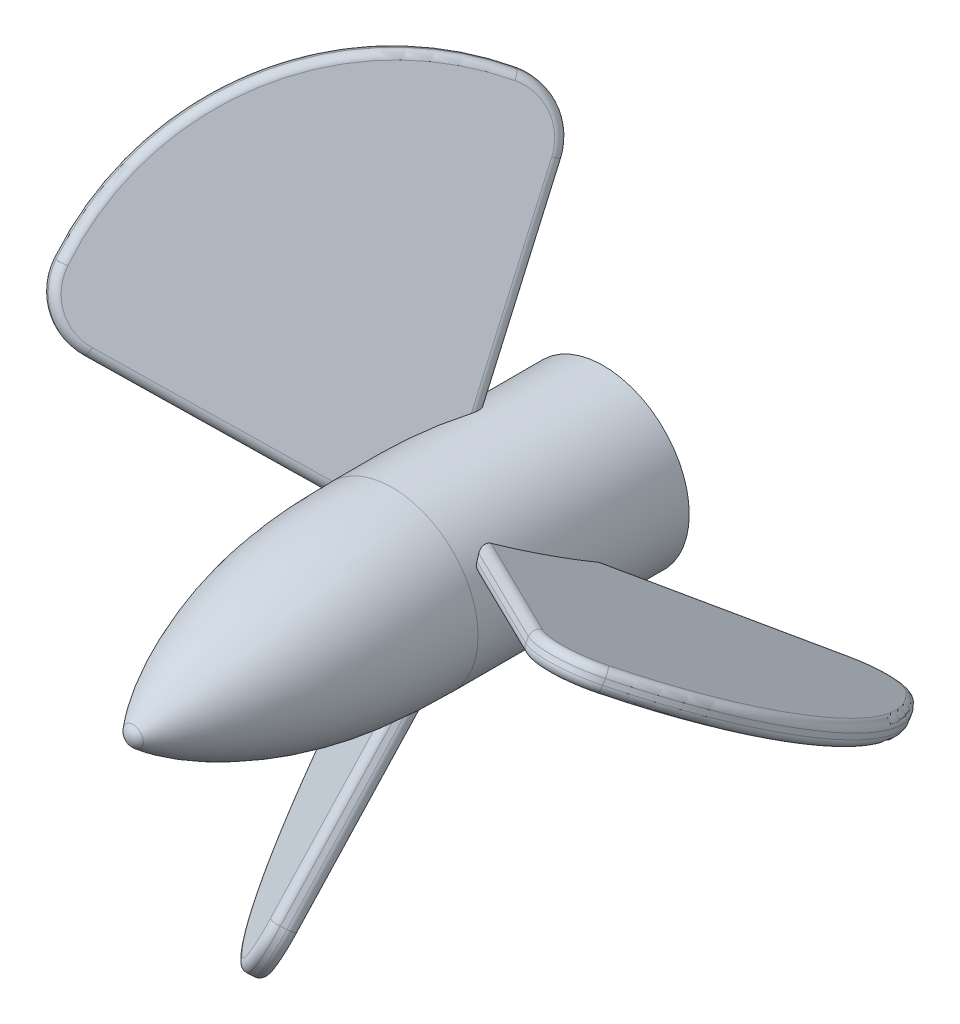
from build123d import *

# Parameters (mm, degrees)
SKETCH1_R                = 3.25
BOSS_EXTRUDE1_DEPTH      = 4
BOSS_EXTRUDE4_DEPTH      = 0.4
FILLET1_R                = 2
CIRPATTERN2_COUNT        = 3
FILLET1_OF_CIRPATTERN2_R = 2
CUT_EXTRUDE1_REACH       = 23.194
FILLET2_R                = 0.3


with BuildPart() as part:
    # Sketch1 → Boss-Extrude1 (new, symmetric)
    with BuildSketch(Plane.XY):
        Circle(SKETCH1_R)
    extrude(amount=BOSS_EXTRUDE1_DEPTH, both=True)

    # Sketch6 → Boss-Extrude4 (add, symmetric)
    with BuildSketch(Plane(origin=(0, 0, 0), x_dir=(-1, 0, 0), z_dir=(0, 0.866025403784438, -0.500000000000001))):
        with BuildLine():
            Line((0, 1.8), (-10, 9.8))
            ThreePointArc((-10, 9.8), (-14, 1.8), (-10, -6.2))
            Line((-10, -6.2), (0, 1.8))
        make_face()
    boss_extrude4 = extrude(amount=BOSS_EXTRUDE4_DEPTH, both=True)

    # Fillet1
    fillet1_edges = [part.edges().sort_by_distance(p)[0] for p in [
        (10, 4.9, 8.487048957),
        (10, -3.1, -5.369357503),
    ]]
    fillet(fillet1_edges, radius=FILLET1_R)

    # CirPattern2: Boss-Extrude4 ×3 about axis
    cirpattern2_axis = Axis((0, 0, 0), (0, 0, 1))
    for i in range(1, CIRPATTERN2_COUNT):
        add(boss_extrude4.rotate(cirpattern2_axis, i * 360 / CIRPATTERN2_COUNT))

    # Fillet1 of CirPattern2
    fillet1_of_cirpattern2_edges = [part.edges().sort_by_distance(p)[0] for p in [
        (-9.243524479, 6.210254038, 8.487048957),
        (-2.315321248, 10.210254038, -5.369357503),
        (-0.756475521, -11.110254038, 8.487048957),
        (-7.684678752, -7.110254038, -5.369357503),
    ]]
    fillet(fillet1_of_cirpattern2_edges, radius=FILLET1_OF_CIRPATTERN2_R)

    # Sketch7 → Cut-Extrude1 (cut, up to next)
    with BuildSketch(Plane.XY.offset(4), mode=Mode.PRIVATE) as cut_extrude1_sk1:
        with BuildLine():
            Line((2.291287847, 1), (1, 1))
            Line((1, 1), (1, 2.291287847))
            ThreePointArc((1, 2.291287847), (0, 2.5), (-1, 2.291287847))
            Line((-1, 2.291287847), (-1, 1))
            Line((-1, 1), (-2.291287847, 1))
            ThreePointArc((-2.291287847, 1), (-2.5, 0), (-2.291287847, -1))
            Line((-2.291287847, -1), (-1, -1))
            Line((-1, -1), (-1, -2.291287847))
            ThreePointArc((-1, -2.291287847), (0, -2.5), (1, -2.291287847))
            Line((1, -2.291287847), (1, -1))
            Line((1, -1), (2.291287847, -1))
            ThreePointArc((2.291287847, -1), (2.5, 0), (2.291287847, 1))
        make_face()
    cut_extrude1_tool1 = extrude(cut_extrude1_sk1.sketch, amount=-CUT_EXTRUDE1_REACH, mode=Mode.PRIVATE) & part.part
    add(cut_extrude1_tool1.solids().sort_by_distance((0, 0, 4))[0], mode=Mode.SUBTRACT)

    # Fillet2
    # the kernel refuses this fillet: 0.3 mm, written as the material it takes off along each edge
    with BuildSketch(Plane(origin=(0.141060168, -2.625278602, 3.285148213), x_dir=(-0.6504736367775011, -0.3457845784397004, -0.6762522260005731), z_dir=(-0.1199335143212854, -0.8324259878891807, 0.5410017808004589))) as fillet2_piece_1_section:
        with BuildLine():
            CenterArc((FILLET2_R, FILLET2_R), FILLET2_R, 180, 90)
            Line((0, FILLET2_R), (0, 0))
            Line((0, 0), (FILLET2_R, 0))
        make_face()
    fillet2_piece_1 = extrude(amount=8.286659003, mode=Mode.PRIVATE)
    fillet2_piece_1 = fillet2_piece_1 - Plane(origin=(0, 0, 5.631920984), x_dir=(1, 0, 0), z_dir=(0, 0, 1)) * Cylinder(3.25, 18, mode=Mode.PRIVATE)
    add(fillet2_piece_1, mode=Mode.SUBTRACT)
    with BuildSketch(Plane(origin=(-2.153735242, -10.214878066, 6.415741038), x_dir=(0.6504736367775003, 0.3457845784397016, 0.6762522260005733), z_dir=(0.11993351432128488, 0.8324259878891804, -0.5410017808004595))) as fillet2_piece_2:
        with BuildLine():
            CenterArc((2 - FILLET2_R, FILLET2_R), FILLET2_R, 270, 90)
            Line((2, FILLET2_R), (2, 0))
            Line((2, 0), (2 - FILLET2_R, 0))
        make_face()
    revolve(axis=Axis((-2.153735242, -10.214878066, 6.415741038), (0.7499999999999993, -0.43301270189221935, -0.500000000000001)), revolution_arc=86.425431617, mode=Mode.SUBTRACT)
    with BuildSketch(Plane(origin=(-1.520577137, -3.740896534, 1.758845727), x_dir=(-0.07914476321236406, -0.8092476914493976, 0.5821119139305425), z_dir=(0.6566856983794149, 0.3970115538417245, 0.6412064563462534))) as fillet2_piece_3:
        with BuildLine():
            CenterArc((10 - FILLET2_R, FILLET2_R), FILLET2_R, 270, 90)
            Line((10, FILLET2_R), (10, 0))
            Line((10, 0), (10 - FILLET2_R, 0))
        make_face()
    revolve(axis=Axis((-1.520577137, -3.740896534, 1.758845727), (0.7499999999999994, -0.43301270189221935, -0.500000000000001)), revolution_arc=84.468753274, mode=Mode.SUBTRACT)
    with BuildSketch(Plane(origin=(-6.810630554, -7.526218304, -2.898049585), x_dir=(-0.02577858922307508, 0.7362189831612175, -0.6762522260005738), z_dir=(0.6609352951217456, 0.5200784641119675, 0.5410017808004592))) as fillet2_piece_4:
        with BuildLine():
            CenterArc((2 - FILLET2_R, -FILLET2_R), FILLET2_R, 360, 90)
            Line((2, -FILLET2_R), (2, 0))
            Line((2, 0), (2 - FILLET2_R, 0))
        make_face()
    revolve(axis=Axis((-6.810630554, -7.526218304, -2.898049585), (-0.7499999999999993, 0.43301270189221935, 0.500000000000001)), revolution_arc=86.425431617, mode=Mode.SUBTRACT)
    with BuildSketch(Plane(origin=(0.802298228, -2.546652, 2.608912668), x_dir=(-0.75, 0.43301270189221897, 0.5000000000000002), z_dir=(-0.1199335143212854, -0.8324259878891807, 0.5410017808004589))) as fillet2_piece_5_section:
        with BuildLine():
            CenterArc((FILLET2_R, FILLET2_R), FILLET2_R, 180, 90)
            Line((0, FILLET2_R), (0, 0))
            Line((0, 0), (FILLET2_R, 0))
        make_face()
    fillet2_piece_5 = extrude(amount=8.797259068, mode=Mode.PRIVATE)
    fillet2_piece_5 = fillet2_piece_5 - Plane(origin=(0, 0, 5.187414001), x_dir=(1, 0, 0), z_dir=(0, 0, 1)) * Cylinder(3.25, 19, mode=Mode.PRIVATE)
    add(fillet2_piece_5, mode=Mode.SUBTRACT)
    with BuildSketch(Plane(origin=(-1.553735242, -10.561288227, 6.015741038), x_dir=(0.6504736367775001, 0.3457845784397007, 0.6762522260005741), z_dir=(0.11993351432128568, 0.8324259878891809, -0.5410017808004588))) as fillet2_piece_6:
        with BuildLine():
            CenterArc((2 - FILLET2_R, -FILLET2_R), FILLET2_R, 0, 90)
            Line((2 - FILLET2_R, 0), (2, 0))
            Line((2, 0), (2, -FILLET2_R))
        make_face()
    revolve(axis=Axis((-1.553735242, -10.561288227, 6.015741038), (0.7499999999999993, -0.43301270189221935, -0.500000000000001)), revolution_arc=86.425431617, mode=Mode.SUBTRACT)
    with BuildSketch(Plane(origin=(-0.920577137, -4.087306696, 1.358845727), x_dir=(-0.07914476321236406, -0.8092476914493976, 0.5821119139305424), z_dir=(0.6566856983794148, 0.3970115538417244, 0.6412064563462534))) as fillet2_piece_7:
        with BuildLine():
            CenterArc((10 - FILLET2_R, -FILLET2_R), FILLET2_R, 360, 90)
            Line((10 - FILLET2_R, 0), (10, 0))
            Line((10, 0), (10, -FILLET2_R))
        make_face()
    revolve(axis=Axis((-0.920577137, -4.087306696, 1.358845727), (0.7499999999999994, -0.43301270189221935, -0.500000000000001)), revolution_arc=84.468753274, mode=Mode.SUBTRACT)
    with BuildSketch(Plane(origin=(-6.210630554, -7.872628466, -3.298049585), x_dir=(-0.025778589223075077, 0.7362189831612174, -0.6762522260005739), z_dir=(0.6609352951217456, 0.5200784641119675, 0.5410017808004592))) as fillet2_piece_8:
        with BuildLine():
            CenterArc((2 - FILLET2_R, FILLET2_R), FILLET2_R, 270, 90)
            Line((2 - FILLET2_R, 0), (2, 0))
            Line((2, 0), (2, FILLET2_R))
        make_face()
    revolve(axis=Axis((-6.210630554, -7.872628466, -3.298049585), (-0.7499999999999993, 0.43301270189221935, 0.500000000000001)), revolution_arc=86.425431617, mode=Mode.SUBTRACT)
    with BuildSketch(Plane(origin=(-2.60661444, 0.578515353, 2.608912668), x_dir=(0.7499999999999996, 0.4330127018922189, 0.500000000000001), z_dir=(-0.6609352951217454, 0.5200784641119681, 0.541001780800459))) as fillet2_piece_9_section:
        with BuildLine():
            CenterArc((FILLET2_R, FILLET2_R), FILLET2_R, 180, 90)
            Line((0, FILLET2_R), (0, 0))
            Line((0, 0), (FILLET2_R, 0))
        make_face()
    fillet2_piece_9 = extrude(amount=8.797259068, mode=Mode.PRIVATE)
    fillet2_piece_9 = fillet2_piece_9 - Plane(origin=(0, 0, 5.187414001), x_dir=(1, 0, 0), z_dir=(0, 0, 1)) * Cylinder(3.25, 19, mode=Mode.PRIVATE)
    add(fillet2_piece_9, mode=Mode.SUBTRACT)
    with BuildSketch(Plane(origin=(-8.369476281, 6.626218304, 6.015741038), x_dir=(-0.025778589223075524, -0.7362189831612175, 0.6762522260005738), z_dir=(0.6609352951217453, -0.5200784641119679, -0.5410017808004594))) as fillet2_piece_10:
        with BuildLine():
            CenterArc((2 - FILLET2_R, -FILLET2_R), FILLET2_R, 360, 90)
            Line((2, -FILLET2_R), (2, 0))
            Line((2, 0), (2 - FILLET2_R, 0))
        make_face()
    revolve(axis=Axis((-8.369476281, 6.626218304, 6.015741038), (-0.7499999999999997, -0.43301270189221885, -0.500000000000001)), revolution_arc=86.425431617, mode=Mode.SUBTRACT)
    with BuildSketch(Plane(origin=(-3.079422863, 2.840896534, 1.358845727), x_dir=(-0.6612566771429075, 0.47316522124311, 0.5821119139305425), z_dir=(0.015479242033159563, -0.767212274019361, 0.6412064563462534))) as fillet2_piece_11:
        with BuildLine():
            CenterArc((10 - FILLET2_R, -FILLET2_R), FILLET2_R, 360, 90)
            Line((10, -FILLET2_R), (10, 0))
            Line((10, 0), (10 - FILLET2_R, 0))
        make_face()
    revolve(axis=Axis((-3.079422863, 2.840896534, 1.358845727), (-0.7499999999999996, -0.4330127018922189, -0.5000000000000009)), revolution_arc=84.468753274, mode=Mode.SUBTRACT)
    with BuildSketch(Plane(origin=(-2.411633696, 8.623308909, -4.650554037), x_dir=(0.7500000000000003, 0.4330127018922185, 0.5000000000000003), z_dir=(0.1199335143212847, -0.8324259878891807, 0.5410017808004591))) as fillet2_piece_12_section:
        with BuildLine():
            CenterArc((FILLET2_R, FILLET2_R), FILLET2_R, 180, 90)
            Line((0, FILLET2_R), (0, 0))
            Line((0, 0), (FILLET2_R, 0))
        make_face()
    fillet2_piece_12 = extrude(amount=7.696442639, mode=Mode.PRIVATE)
    fillet2_piece_12 = fillet2_piece_12 - Plane(origin=(0, 0, -2.676169884), x_dir=(1, 0, 0), z_dir=(0, 0, 1)) * Cylinder(3.25, 17, mode=Mode.PRIVATE)
    add(fillet2_piece_12, mode=Mode.SUBTRACT)
    with BuildSketch(Plane(origin=(-1.811633696, 8.969719071, -4.250554037), x_dir=(-0.6504736367774975, 0.34578457843970306, 0.6762522260005753), z_dir=(0.1199335143212847, -0.8324259878891807, 0.5410017808004591))) as fillet2_piece_13_section:
        with BuildLine():
            CenterArc((FILLET2_R, FILLET2_R), FILLET2_R, 180, 90)
            Line((0, FILLET2_R), (0, 0))
            Line((0, 0), (FILLET2_R, 0))
        make_face()
    fillet2_piece_13 = extrude(amount=7.797734243, mode=Mode.PRIVATE)
    fillet2_piece_13 = fillet2_piece_13 - Plane(origin=(0, 0, -2.323653789), x_dir=(1, 0, 0), z_dir=(0, 0, 1)) * Cylinder(3.25, 17, mode=Mode.PRIVATE)
    add(fillet2_piece_13, mode=Mode.SUBTRACT)
    with BuildSketch(Plane(origin=(-2.344088045, 1.190477612, 3.285148213), x_dir=(0.025778589223076687, 0.7362189831612178, -0.6762522260005733), z_dir=(-0.6609352951217454, 0.5200784641119681, 0.541001780800459))) as fillet2_piece_14_section:
        with BuildLine():
            CenterArc((FILLET2_R, FILLET2_R), FILLET2_R, 180, 90)
            Line((0, FILLET2_R), (0, 0))
            Line((0, 0), (FILLET2_R, 0))
        make_face()
    fillet2_piece_14 = extrude(amount=8.286659003, mode=Mode.PRIVATE)
    fillet2_piece_14 = fillet2_piece_14 - Plane(origin=(0, 0, 5.631920983), x_dir=(1, 0, 0), z_dir=(0, 0, 1)) * Cylinder(3.25, 18, mode=Mode.PRIVATE)
    add(fillet2_piece_14, mode=Mode.SUBTRACT)
    with BuildSketch(Plane(origin=(-7.769476281, 6.972628466, 6.415741038), x_dir=(-0.025778589223075524, -0.7362189831612175, 0.6762522260005738), z_dir=(0.6609352951217453, -0.5200784641119679, -0.5410017808004594))) as fillet2_piece_15:
        with BuildLine():
            CenterArc((2 - FILLET2_R, FILLET2_R), FILLET2_R, 270, 90)
            Line((2, FILLET2_R), (2, 0))
            Line((2, 0), (2 - FILLET2_R, 0))
        make_face()
    revolve(axis=Axis((-7.769476281, 6.972628466, 6.415741038), (-0.7499999999999997, -0.43301270189221885, -0.500000000000001)), revolution_arc=86.425431617, mode=Mode.SUBTRACT)
    with BuildSketch(Plane(origin=(-2.479422863, 3.187306696, 1.758845727), x_dir=(-0.6612566771429075, 0.47316522124311017, 0.5821119139305423), z_dir=(0.015479242033159424, -0.7672122740193608, 0.6412064563462534))) as fillet2_piece_16:
        with BuildLine():
            CenterArc((10 - FILLET2_R, FILLET2_R), FILLET2_R, 270, 90)
            Line((10, FILLET2_R), (10, 0))
            Line((10, 0), (10 - FILLET2_R, 0))
        make_face()
    revolve(axis=Axis((-2.479422863, 3.187306696, 1.758845727), (-0.7499999999999996, -0.4330127018922189, -0.5000000000000009)), revolution_arc=84.468753274, mode=Mode.SUBTRACT)
    with BuildSketch(Plane(origin=(8.673821428, -2.915938733, -4.250554037), x_dir=(0.6246950475544244, 0.39043440472151686, 0.6762522260005732), z_dir=(-0.7808688094430304, 0.3123475237772128, 0.5410017808004591))) as fillet2_piece_17_section:
        with BuildLine():
            CenterArc((FILLET2_R, FILLET2_R), FILLET2_R, 180, 90)
            Line((0, FILLET2_R), (0, 0))
            Line((0, 0), (FILLET2_R, 0))
        make_face()
    fillet2_piece_17 = extrude(amount=7.797734243, mode=Mode.PRIVATE)
    fillet2_piece_17 = fillet2_piece_17 - Plane(origin=(0, 0, -2.323653789), x_dir=(1, 0, 0), z_dir=(0, 0, 1)) * Cylinder(3.25, 17, mode=Mode.PRIVATE)
    add(fillet2_piece_17, mode=Mode.SUBTRACT)
    with BuildSketch(Plane(origin=(9.923211523, -2.135069923, -2.898049585), x_dir=(-0.6246950475544243, -0.3904344047215159, -0.676252226000574), z_dir=(-0.7808688094430306, 0.31234752377721275, 0.5410017808004591))) as fillet2_piece_18:
        with BuildLine():
            CenterArc((2 - FILLET2_R, -FILLET2_R), FILLET2_R, 360, 90)
            Line((2, -FILLET2_R), (2, 0))
            Line((2, 0), (2 - FILLET2_R, 0))
        make_face()
    revolve(axis=Axis((9.923211523, -2.135069923, -2.898049585), (0, -0.8660254037844382, 0.500000000000001)), revolution_arc=86.425431617, mode=Mode.SUBTRACT)
    with BuildSketch(Plane(origin=(4, 0.553589838, 1.758845727), x_dir=(0.7404014403552713, 0.33608247020628784, 0.5821119139305423), z_dir=(-0.6721649404125742, 0.3702007201776364, 0.6412064563462535))) as fillet2_piece_19:
        with BuildLine():
            CenterArc((10 - FILLET2_R, FILLET2_R), FILLET2_R, 270, 90)
            Line((10, FILLET2_R), (10, 0))
            Line((10, 0), (10 - FILLET2_R, 0))
        make_face()
    revolve(axis=Axis((4, 0.553589838, 1.758845727), (0, 0.8660254037844382, -0.500000000000001)), revolution_arc=84.468753274, mode=Mode.SUBTRACT)
    with BuildSketch(Plane(origin=(9.923211523, 3.2422496, 6.415741038), x_dir=(-0.6246950475544236, 0.3904344047215163, 0.6762522260005742), z_dir=(-0.7808688094430309, -0.3123475237772124, -0.5410017808004585))) as fillet2_piece_20:
        with BuildLine():
            CenterArc((2 - FILLET2_R, FILLET2_R), FILLET2_R, 270, 90)
            Line((2, FILLET2_R), (2, 0))
            Line((2, 0), (2 - FILLET2_R, 0))
        make_face()
    revolve(axis=Axis((9.923211523, 3.2422496, 6.415741038), (0, 0.8660254037844382, -0.500000000000001)), revolution_arc=86.425431617, mode=Mode.SUBTRACT)
    with BuildSketch(Plane(origin=(8.673821428, -2.22311841, -4.650554037), x_dir=(0.6246950475544243, 0.39043440472151575, 0.6762522260005739), z_dir=(-0.7808688094430304, 0.3123475237772128, 0.5410017808004591))) as fillet2_piece_21_section:
        with BuildLine():
            CenterArc((FILLET2_R, -FILLET2_R), FILLET2_R, 90, 90)
            Line((0, -FILLET2_R), (0, 0))
            Line((0, 0), (FILLET2_R, 0))
        make_face()
    fillet2_piece_21 = extrude(amount=7.696442639, mode=Mode.PRIVATE)
    fillet2_piece_21 = fillet2_piece_21 - Plane(origin=(0, 0, -2.676170461), x_dir=(1, 0, 0), z_dir=(0, 0, 1)) * Cylinder(3.25, 17, mode=Mode.PRIVATE)
    add(fillet2_piece_21, mode=Mode.SUBTRACT)
    with BuildSketch(Plane(origin=(9.923211523, -1.4422496, -3.298049585), x_dir=(-0.6246950475544243, -0.3904344047215159, -0.6762522260005738), z_dir=(-0.7808688094430304, 0.31234752377721275, 0.5410017808004591))) as fillet2_piece_22:
        with BuildLine():
            CenterArc((2 - FILLET2_R, FILLET2_R), FILLET2_R, 270, 90)
            Line((2, FILLET2_R), (2, 0))
            Line((2, 0), (2 - FILLET2_R, 0))
        make_face()
    revolve(axis=Axis((9.923211523, -1.4422496, -3.298049585), (0, -0.8660254037844382, 0.500000000000001)), revolution_arc=86.425431617, mode=Mode.SUBTRACT)
    with BuildSketch(Plane(origin=(4, 1.246410162, 1.358845727), x_dir=(0.7404014403552713, 0.33608247020628784, 0.5821119139305423), z_dir=(-0.6721649404125742, 0.3702007201776364, 0.6412064563462535))) as fillet2_piece_23:
        with BuildLine():
            CenterArc((10 - FILLET2_R, -FILLET2_R), FILLET2_R, 0, 90)
            Line((10, -FILLET2_R), (10, 0))
            Line((10, 0), (10 - FILLET2_R, 0))
        make_face()
    revolve(axis=Axis((4, 1.246410162, 1.358845727), (0, 0.8660254037844382, -0.500000000000001)), revolution_arc=84.468753274, mode=Mode.SUBTRACT)
    with BuildSketch(Plane(origin=(9.923211523, 3.935069923, 6.015741038), x_dir=(-0.6246950475544235, 0.390434404721516, 0.6762522260005746), z_dir=(-0.7808688094430312, -0.31234752377721237, -0.5410017808004585))) as fillet2_piece_24:
        with BuildLine():
            CenterArc((2 - FILLET2_R, -FILLET2_R), FILLET2_R, 360, 90)
            Line((2, -FILLET2_R), (2, 0))
            Line((2, 0), (2 - FILLET2_R, 0))
        make_face()
    revolve(axis=Axis((9.923211523, 3.935069923, 6.015741038), (0, 0.8660254037844382, -0.500000000000001)), revolution_arc=86.425431617, mode=Mode.SUBTRACT)
    with BuildSketch(Plane(origin=(-6.862187732, -6.053780338, -4.250554037), x_dir=(0.02577858922307396, -0.7362189831612166, 0.6762522260005746), z_dir=(0.6609352951217458, 0.5200784641119676, 0.5410017808004591))) as fillet2_piece_25_section:
        with BuildLine():
            CenterArc((FILLET2_R, FILLET2_R), FILLET2_R, 180, 90)
            Line((0, FILLET2_R), (0, 0))
            Line((0, 0), (FILLET2_R, 0))
        make_face()
    fillet2_piece_25 = extrude(amount=7.797734243, mode=Mode.PRIVATE)
    fillet2_piece_25 = fillet2_piece_25 - Plane(origin=(0, 0, -2.323653789), x_dir=(1, 0, 0), z_dir=(0, 0, 1)) * Cylinder(3.25, 17, mode=Mode.PRIVATE)
    add(fillet2_piece_25, mode=Mode.SUBTRACT)
    with BuildSketch(Plane(origin=(-6.262187732, -6.4001905, -4.650554037), x_dir=(-0.7499999999999993, 0.4330127018922195, 0.5000000000000009), z_dir=(0.6609352951217458, 0.5200784641119676, 0.5410017808004591))) as fillet2_piece_26_section:
        with BuildLine():
            CenterArc((FILLET2_R, FILLET2_R), FILLET2_R, 180, 90)
            Line((0, FILLET2_R), (0, 0))
            Line((0, 0), (FILLET2_R, 0))
        make_face()
    fillet2_piece_26 = extrude(amount=7.696442639, mode=Mode.PRIVATE)
    fillet2_piece_26 = fillet2_piece_26 - Plane(origin=(0, 0, -2.676169884), x_dir=(1, 0, 0), z_dir=(0, 0, 1)) * Cylinder(3.25, 17, mode=Mode.PRIVATE)
    add(fillet2_piece_26, mode=Mode.SUBTRACT)
    with BuildSketch(Plane(origin=(-3.712580969, 9.314878066, -3.298049585), x_dir=(0.6504736367775, -0.3457845784397024, -0.6762522260005733), z_dir=(0.11993351432128416, -0.8324259878891804, 0.5410017808004597))) as fillet2_piece_27:
        with BuildLine():
            CenterArc((2 - FILLET2_R, FILLET2_R), FILLET2_R, 270, 90)
            Line((2, FILLET2_R), (2, 0))
            Line((2, 0), (2 - FILLET2_R, 0))
        make_face()
    revolve(axis=Axis((-3.712580969, 9.314878066, -3.298049585), (0.7499999999999997, 0.43301270189221885, 0.500000000000001)), revolution_arc=86.425431617, mode=Mode.SUBTRACT)
    with BuildSketch(Plane(origin=(-3.112580969, 9.661288227, -2.898049585), x_dir=(0.6504736367774999, -0.34578457843970156, -0.6762522260005739), z_dir=(0.1199335143212848, -0.8324259878891808, 0.541001780800459))) as fillet2_piece_28:
        with BuildLine():
            CenterArc((2 - FILLET2_R, -FILLET2_R), FILLET2_R, 0, 90)
            Line((2, -FILLET2_R), (2, 0))
            Line((2, 0), (2 - FILLET2_R, 0))
        make_face()
    revolve(axis=Axis((-3.112580969, 9.661288227, -2.898049585), (0.7499999999999997, 0.43301270189221885, 0.500000000000001)), revolution_arc=86.425431617, mode=Mode.SUBTRACT)
    with BuildSketch(Plane(origin=(2.203027877, 1.434800989, 3.285148213), x_dir=(0, 0.866025403784438, -0.500000000000001), z_dir=(0.7808688094430305, 0.31234752377721275, 0.541001780800459))) as fillet2_piece_29_section:
        with BuildLine():
            CenterArc((FILLET2_R, -FILLET2_R), FILLET2_R, 90, 90)
            Line((0, -FILLET2_R), (0, 0))
            Line((0, 0), (FILLET2_R, 0))
        make_face()
    fillet2_piece_29 = extrude(amount=8.286659003, mode=Mode.PRIVATE)
    fillet2_piece_29 = fillet2_piece_29 - Plane(origin=(0, 0, 5.63192096), x_dir=(1, 0, 0), z_dir=(0, 0, 1)) * Cylinder(3.25, 18, mode=Mode.PRIVATE)
    add(fillet2_piece_29, mode=Mode.SUBTRACT)
    with BuildSketch(Plane(origin=(1.804316213, 1.968136647, 2.608912668), x_dir=(0.6246950475544241, -0.39043440472151636, -0.6762522260005736), z_dir=(0.7808688094430305, 0.31234752377721275, 0.541001780800459))) as fillet2_piece_30_section:
        with BuildLine():
            CenterArc((FILLET2_R, -FILLET2_R), FILLET2_R, 90, 90)
            Line((0, -FILLET2_R), (0, 0))
            Line((0, 0), (FILLET2_R, 0))
        make_face()
    fillet2_piece_30 = extrude(amount=8.797259068, mode=Mode.PRIVATE)
    fillet2_piece_30 = fillet2_piece_30 - Plane(origin=(0, 0, 5.187414028), x_dir=(1, 0, 0), z_dir=(0, 0, 1)) * Cylinder(3.25, 19, mode=Mode.PRIVATE)
    add(fillet2_piece_30, mode=Mode.SUBTRACT)

    # Sketch8 → Revolve1 (revolve)
    with BuildSketch(Plane(origin=(0, 0, 0), x_dir=(0, 0, -1), z_dir=(1, 0, 0)), mode=Mode.PRIVATE) as revolve1_sk:
        with BuildLine():
            Line((-4, 3.25), (-4, 0))
            Line((-4, 0), (-14, 0))
            ThreePointArc((-14, 0), (-13.952962882, 0.211718275), (-13.820701489, 0.383602079))
            add(Edge.make_bspline(
                [(-4, 3.25), (-6.44735662, 3.25), (-9.526782619, 2.855989386), (-12.913211168, 1.142288001), (-13.820701489, 0.383602079)],
                knots=[0, 0, 0, 0, 0.632394879, 0.948754243, 0.948754243, 0.948754243, 0.948754243], degree=3))
        make_face()
    revolve(revolve1_sk.sketch.rotate(Axis((0, 0, 4), (0, 0, 1)), 270), axis=Axis((0, 0, 4), (0, 0, 1)))


solid = part.part
